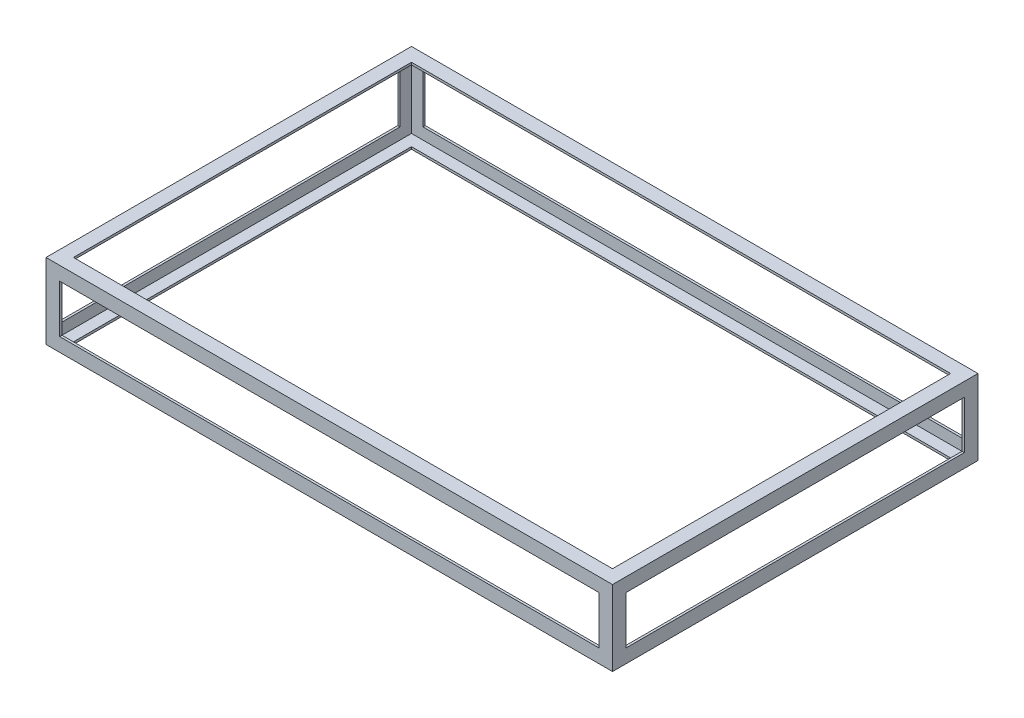
from build123d import *

# Parameters (mm, degrees)
BOTTOM_HORIZONTAL_ANGLE_DEPTH   = 1574.8
BOTTOM_HORIZONTAL_ANGLE_2_DEPTH = 1574.8
BOTTOM_HORIZONTAL_ANGLE_3_DEPTH = 1574.8
BOTTOM_HORIZONTAL_ANGLE_4_DEPTH = 1574.8
FRONT_VERTIAL_ANGLE_DEPTH       = 209.55
BOSS_EXTRUDE9_REACH             = 1684.546
BOSS_EXTRUDE9_DIRECTION_2_REACH = 1684.546
SKETCH25_R                      = 12.85875
CUT_EXTRUDE3_DEPTH              = 717.042


with BuildPart() as part:
    # Sketch5 → Bottom Horizontal Angle (new body)
    with BuildSketch(Plane(origin=(0, 0, 0), x_dir=(0, 0, -1), z_dir=(1, 0, 0))):
        Polygon((-508, -304.8), (-508, -266.7), (-501.65, -266.7), (-501.65, -298.45), (-469.9, -298.45), (-469.9, -304.8), align=None)
    extrude(amount=BOTTOM_HORIZONTAL_ANGLE_DEPTH)



with BuildPart() as body_2:
    # Sketch5 → Bottom Horizontal Angle 2 (new body)
    with BuildSketch(Plane(origin=(0, 0, 0), x_dir=(0, 0, -1), z_dir=(1, 0, 0))):
        Polygon((501.65, -266.7), (508, -266.7), (508, -304.8), (469.9, -304.8), (469.9, -298.45), (501.65, -298.45), align=None)
    extrude(amount=BOTTOM_HORIZONTAL_ANGLE_2_DEPTH)


with BuildPart() as body_3:
    # Sketch5 → Bottom Horizontal Angle 3 (new body)
    with BuildSketch(Plane(origin=(0, 0, 0), x_dir=(0, 0, -1), z_dir=(1, 0, 0))):
        Polygon((508, -95.25), (508, -133.35), (501.65, -133.35), (501.65, -101.6), (469.9, -101.6), (469.9, -95.25), align=None)
    extrude(amount=BOTTOM_HORIZONTAL_ANGLE_3_DEPTH)


with BuildPart() as body_4:
    # Sketch5 → Bottom Horizontal Angle 4 (new body)
    with BuildSketch(Plane(origin=(0, 0, 0), x_dir=(0, 0, -1), z_dir=(1, 0, 0))):
        Polygon((-501.65, -133.35), (-508, -133.35), (-508, -95.25), (-469.9, -95.25), (-469.9, -101.6), (-501.65, -101.6), align=None)
    extrude(amount=BOTTOM_HORIZONTAL_ANGLE_4_DEPTH)


with BuildPart() as part_1:
    add(part.part)

    add(body_2.part)  # Front Vertial Angle merges body 2

    add(body_3.part)  # Front Vertial Angle merges body 3

    add(body_4.part)  # Front Vertial Angle merges body 4
    # Sketch6 → Front Vertial Angle (add)
    with BuildSketch(Plane.XZ.offset(304.8)):
        Polygon((1574.8, -508), (1536.7, -508), (1536.7, -501.65), (1568.45, -501.65), (1568.45, -469.9), (1574.8, -469.9), align=None)
        Polygon((1536.7, 501.65), (1536.7, 508), (1574.8, 508), (1574.8, 469.9), (1568.45, 469.9), (1568.45, 501.65), align=None)
        Polygon((0, 508), (38.1, 508), (38.1, 501.65), (6.35, 501.65), (6.35, 469.9), (0, 469.9), align=None)
        Polygon((38.1, -501.65), (38.1, -508), (0, -508), (0, -469.9), (6.35, -469.9), (6.35, -501.65), align=None)
    extrude(amount=-FRONT_VERTIAL_ANGLE_DEPTH)

    # Sketch15 → Boss-Extrude9 (add, up to next)
    with BuildSketch(Plane.XY, mode=Mode.PRIVATE) as boss_extrude9_sk1:
        Polygon((0, -266.7), (0, -304.8), (38.1, -304.8), (38.1, -298.45), (6.35, -298.45), (6.35, -266.7), align=None)
    boss_extrude9_tool1 = extrude(boss_extrude9_sk1.sketch, amount=-BOSS_EXTRUDE9_REACH, mode=Mode.PRIVATE) - part_1.part
    # Sketch15 → Boss-Extrude9 (add, up to next)
    with BuildSketch(Plane.XY, mode=Mode.PRIVATE) as boss_extrude9_sk2:
        Polygon((1568.45, -266.7), (1574.8, -266.7), (1574.8, -304.8), (1536.7, -304.8), (1536.7, -298.45), (1568.45, -298.45), align=None)
    boss_extrude9_tool2 = extrude(boss_extrude9_sk2.sketch, amount=-BOSS_EXTRUDE9_REACH, mode=Mode.PRIVATE) - part_1.part
    # Sketch15 → Boss-Extrude9 (add, up to next)
    with BuildSketch(Plane.XY, mode=Mode.PRIVATE) as boss_extrude9_sk3:
        Polygon((1574.8, -133.35), (1574.8, -95.25), (1536.7, -95.25), (1536.7, -101.6), (1568.45, -101.6), (1568.45, -133.35), align=None)
    boss_extrude9_tool3 = extrude(boss_extrude9_sk3.sketch, amount=-BOSS_EXTRUDE9_REACH, mode=Mode.PRIVATE) - part_1.part
    # Sketch15 → Boss-Extrude9 (add, up to next)
    with BuildSketch(Plane.XY, mode=Mode.PRIVATE) as boss_extrude9_sk4:
        Polygon((6.35, -133.35), (0, -133.35), (0, -95.25), (38.1, -95.25), (38.1, -101.6), (6.35, -101.6), align=None)
    boss_extrude9_tool4 = extrude(boss_extrude9_sk4.sketch, amount=-BOSS_EXTRUDE9_REACH, mode=Mode.PRIVATE) - part_1.part
    add(boss_extrude9_tool1.solids().sort_by_distance((0.538815, -285.75, 0))[0])
    add(boss_extrude9_tool2.solids().sort_by_distance((1571.625, -267.238815, 0))[0])
    add(boss_extrude9_tool3.solids().sort_by_distance((1574.261185, -114.3, 0))[0])
    add(boss_extrude9_tool4.solids().sort_by_distance((3.175, -132.811185, 0))[0])

    # Sketch15 → Boss-Extrude9 direction 2 (add, up to next)
    with BuildSketch(Plane.XY, mode=Mode.PRIVATE) as boss_extrude9_direction_2_sk1:
        Polygon((0, -266.7), (0, -304.8), (38.1, -304.8), (38.1, -298.45), (6.35, -298.45), (6.35, -266.7), align=None)
    boss_extrude9_direction_2_tool1 = extrude(boss_extrude9_direction_2_sk1.sketch, amount=BOSS_EXTRUDE9_DIRECTION_2_REACH, mode=Mode.PRIVATE) - part_1.part
    # Sketch15 → Boss-Extrude9 direction 2 (add, up to next)
    with BuildSketch(Plane.XY, mode=Mode.PRIVATE) as boss_extrude9_direction_2_sk2:
        Polygon((1568.45, -266.7), (1574.8, -266.7), (1574.8, -304.8), (1536.7, -304.8), (1536.7, -298.45), (1568.45, -298.45), align=None)
    boss_extrude9_direction_2_tool2 = extrude(boss_extrude9_direction_2_sk2.sketch, amount=BOSS_EXTRUDE9_DIRECTION_2_REACH, mode=Mode.PRIVATE) - part_1.part
    # Sketch15 → Boss-Extrude9 direction 2 (add, up to next)
    with BuildSketch(Plane.XY, mode=Mode.PRIVATE) as boss_extrude9_direction_2_sk3:
        Polygon((1574.8, -133.35), (1574.8, -95.25), (1536.7, -95.25), (1536.7, -101.6), (1568.45, -101.6), (1568.45, -133.35), align=None)
    boss_extrude9_direction_2_tool3 = extrude(boss_extrude9_direction_2_sk3.sketch, amount=BOSS_EXTRUDE9_DIRECTION_2_REACH, mode=Mode.PRIVATE) - part_1.part
    # Sketch15 → Boss-Extrude9 direction 2 (add, up to next)
    with BuildSketch(Plane.XY, mode=Mode.PRIVATE) as boss_extrude9_direction_2_sk4:
        Polygon((6.35, -133.35), (0, -133.35), (0, -95.25), (38.1, -95.25), (38.1, -101.6), (6.35, -101.6), align=None)
    boss_extrude9_direction_2_tool4 = extrude(boss_extrude9_direction_2_sk4.sketch, amount=BOSS_EXTRUDE9_DIRECTION_2_REACH, mode=Mode.PRIVATE) - part_1.part
    add(boss_extrude9_direction_2_tool1.solids().sort_by_distance((0.538815, -285.75, 0))[0])
    add(boss_extrude9_direction_2_tool2.solids().sort_by_distance((1571.625, -267.238815, 0))[0])
    add(boss_extrude9_direction_2_tool3.solids().sort_by_distance((1574.261185, -114.3, 0))[0])
    add(boss_extrude9_direction_2_tool4.solids().sort_by_distance((3.175, -132.811185, 0))[0])

    # Sketch25 → Cut-Extrude3 (cut)
    with BuildSketch(Plane(origin=(1453.531648239, -529.042254523, 0), x_dir=(0, 0, 1), z_dir=(-0.9396926207859077, 0.342020143325671, 0))):
        with Locations((0, 262.741519308)):
            Circle(SKETCH25_R)
    extrude(amount=CUT_EXTRUDE3_DEPTH, mode=Mode.SUBTRACT)


solid = part_1.part
